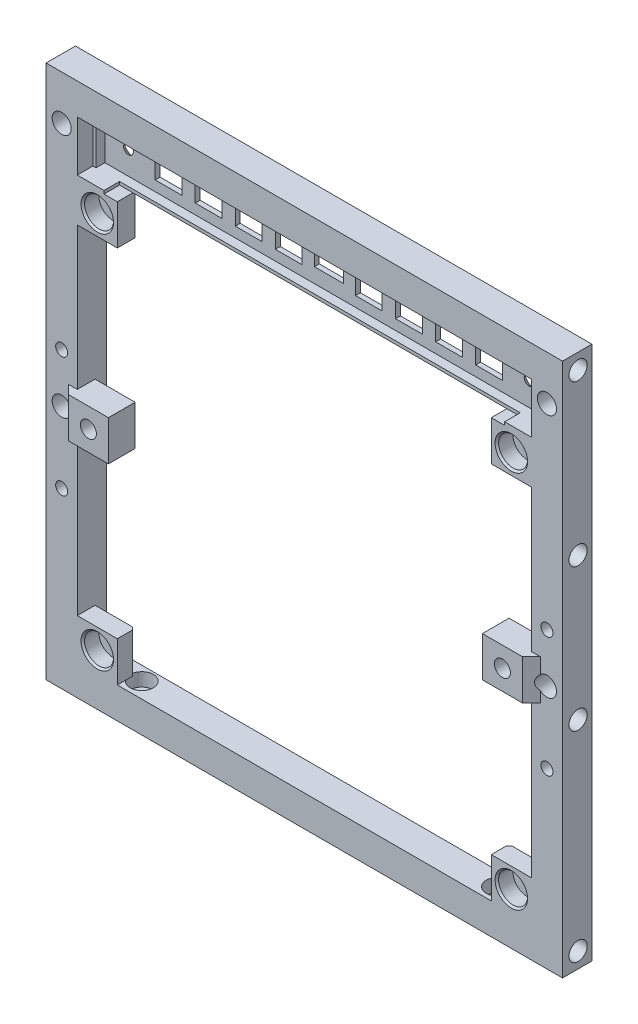
from build123d import *
from build123d.topology import SkipClean

# Parameters (mm, degrees)
SKETCH1_W                = 116
SKETCH1_H                = 120
SKETCH1_W_2              = 102
SKETCH1_H_2              = 106
BOSS_EXTRUDE1_DEPTH      = 7
SKETCH2_R                = 2.05
CUT_EXTRUDE1_DEPTH       = 6
SKETCH3_R                = 1.35
CUT_EXTRUDE2_DEPTH       = 128.208490283
SKETCH4_R                = 2.6
CUT_EXTRUDE3_DEPTH       = 3
SKETCH5_R                = 1.35
CUT_EXTRUDE4_DEPTH       = 84.743656476
SKETCH6_R                = 2.5
CUT_EXTRUDE5_DEPTH       = 3
SKETCH7_R                = 2.15
CUT_EXTRUDE6_DEPTH       = 84.743656476
CUT_EXTRUDE7_DEPTH       = 0.2
SKETCH9_W                = 2.7
SKETCH9_H                = 2.7
CUT_EXTRUDE8_DEPTH       = 0.2
SKETCH10_W               = 6
SKETCH10_H               = 6
BOSS_EXTRUDE2_DEPTH      = 5.5
SKETCH11_R               = 1.65
CUT_EXTRUDE9_DEPTH       = 84.631632771
SKETCH12_W               = 102
SKETCH12_H               = 12
BOSS_EXTRUDE3_DEPTH      = 1.5
SKETCH13_W               = 102
SKETCH13_H               = 12
SKETCH13_W_2             = 100.6
SKETCH13_H_2             = 10.6
BOSS_EXTRUDE4_DEPTH      = 2
SKETCH14_W               = 6
SKETCH14_H               = 6
SKETCH14_W_2             = 6.5
SKETCH14_H_2             = 4
CUT_EXTRUDE10_DEPTH      = 84.631632771
SKETCH15_R               = 1
BOSS_EXTRUDE5_DEPTH      = 2
CHAMFER1_SIZE            = 0.4
CHAMFER2_SIZE            = 0.4
CHAMFER3_SIZE            = 0.4
SKETCH16_W               = 6
SKETCH16_H               = 6
BOSS_EXTRUDE7_DEPTH      = 5.5
SKETCH17_R               = 1.65
CUT_EXTRUDE11_DEPTH      = 84.631632771
CUT_EXTRUDE12_DEPTH      = 84.631632771
CUT_EXTRUDE12_DEPTH_BACK = 84.631632771
SKETCH18_R               = 1.1
CHAMFER4_SIZE            = 1.5
SKETCH19_W               = 102
SKETCH19_H               = 94
CUT_EXTRUDE13_DEPTH      = 84.631632771
SKETCH20_W               = 8
SKETCH20_H               = 8
BOSS_EXTRUDE8_DEPTH      = 7
SKETCH21_R               = 2.15
CUT_EXTRUDE14_DEPTH      = 84.743656476
CHAMFER6_SIZE            = 0.4
CHAMFER7_SIZE            = 0.4
SKETCH22_W               = 102
SKETCH22_H               = 94
CUT_EXTRUDE15_DEPTH      = 84.743656476
BOSS_EXTRUDE9_START      = -4
SKETCH24_W               = 9
SKETCH24_H               = 9
BOSS_EXTRUDE9_DEPTH      = 4
SKETCH25_R               = 3.25
CUT_EXTRUDE16_DEPTH      = 3.6
CHAMFER8_SIZE            = 0.4
CHAMFER9_SIZE            = 0.6
SKETCH26_W               = 9
SKETCH26_H               = 9
BOSS_EXTRUDE10_DEPTH     = 6
SKETCH27_R               = 1.8
CUT_EXTRUDE17_DEPTH      = 84.666002653
CHAMFER10_SIZE           = 2


# Read off the part's stored shape, not the designer's step: Mirror5, Mirror6
# Some blends are built 0.0001 mm under size
with BuildPart() as part:
    # Sketch1 → Boss-Extrude1 (new body)
    with BuildSketch(Plane.XY):
        Rectangle(SKETCH1_W, SKETCH1_H)
        Rectangle(SKETCH1_W_2, SKETCH1_H_2, mode=Mode.SUBTRACT)
    extrude(amount=BOSS_EXTRUDE1_DEPTH)

    # Sketch2 → Cut-Extrude1 (cut)
    with BuildSketch(Plane.ZY.offset(58)):
        with Locations((3.5, -56.5)):
            Circle(SKETCH2_R)
        with Locations((3.5, 56.5)):
            Circle(SKETCH2_R)
        with Locations((3.5, 20.5)):
            Circle(SKETCH2_R)
        with Locations((3.5, -11.5)):
            Circle(SKETCH2_R)
    cut_extrude1 = extrude(amount=-CUT_EXTRUDE1_DEPTH, mode=Mode.SUBTRACT)

    # Mirror1: Cut-Extrude1 across plane
    add(cut_extrude1.mirror(Plane(origin=(0, 0, 0), x_dir=(0, 0, 1), z_dir=(1, 0, 0))), mode=Mode.SUBTRACT)

    # Sketch3 → Cut-Extrude2 (cut, through all)
    with BuildSketch(Plane(origin=(0, -53, 0), x_dir=(1, 0, 0), z_dir=(0, 1, 0))):
        with Locations(Location((40, -3.5, 0), (0, 0, 270))):
            Circle(SKETCH3_R)
        with Locations(Location((-40, -3.5, 0), (0, 0, 270))):
            Circle(SKETCH3_R)
    extrude(amount=-CUT_EXTRUDE2_DEPTH, mode=Mode.SUBTRACT)

    # Sketch4 → Cut-Extrude3 (cut)
    with BuildSketch(Plane(origin=(0, -53, 0), x_dir=(1, 0, 0), z_dir=(0, 1, 0))):
        with Locations(Location((40, -3.5, 0), (0, 0, 270))):
            Circle(SKETCH4_R)
        with Locations(Location((-40, -3.5, 0), (0, 0, 270))):
            Circle(SKETCH4_R)
    extrude(amount=-CUT_EXTRUDE3_DEPTH, mode=Mode.SUBTRACT)

    # Sketch5 → Cut-Extrude4 (cut, through all)
    with BuildSketch(Plane(origin=(0, 0, 0), x_dir=(-1, 0, 0), z_dir=(0, 0, -1))):
        with Locations((-54.5, 6)):
            Circle(SKETCH5_R)
        with Locations(Location((54.5, 6, 0), (0, 0, 180))):
            Circle(SKETCH5_R)
        with Locations((-54.5, -21)):
            Circle(SKETCH5_R)
        with Locations(Location((54.5, -21, 0), (0, 0, 180))):
            Circle(SKETCH5_R)
    extrude(amount=-CUT_EXTRUDE4_DEPTH, mode=Mode.SUBTRACT)

    # Sketch6 → Cut-Extrude5 (cut)
    with BuildSketch(Plane(origin=(0, 0, 0), x_dir=(-1, 0, 0), z_dir=(0, 0, -1))):
        with Locations((-54.5, 6)):
            Circle(SKETCH6_R)
        with Locations((54.5, 6)):
            Circle(SKETCH6_R)
        with Locations((-54.5, -21)):
            Circle(SKETCH6_R)
        with Locations((54.5, -21)):
            Circle(SKETCH6_R)
    extrude(amount=-CUT_EXTRUDE5_DEPTH, mode=Mode.SUBTRACT)

    # Sketch7 → Cut-Extrude6 (cut, through all)
    with BuildSketch(Plane(origin=(0, 0, 0), x_dir=(-1, 0, 0), z_dir=(0, 0, -1))):
        with Locations((-54.5, 50)):
            Circle(SKETCH7_R)
        with Locations((-54.5, -5)):
            Circle(SKETCH7_R)
    cut_extrude6 = extrude(amount=-CUT_EXTRUDE6_DEPTH, mode=Mode.SUBTRACT)

    # Mirror2: Cut-Extrude6 across plane
    add(cut_extrude6.mirror(Plane(origin=(0, 0, 0), x_dir=(0, 0, 1), z_dir=(1, 0, 0))), mode=Mode.SUBTRACT)

    # Sketch8 → Cut-Extrude7 (cut)
    with SkipClean():  # the faces are left unmerged after this step: merging them gives an invalid solid
        with BuildSketch(Plane(origin=(0, 0, 3), x_dir=(-1, 0, 0), z_dir=(0, 0, -1))):
            with BuildLine():
                Line((-55.85, 3.895837459), (-55.85, 8.104162541))
                ThreePointArc((-55.85, 8.104162541), (-54.5, 8.5), (-53.15, 8.104162541))
                Line((-53.15, 8.104162541), (-53.15, 3.895837459))
                ThreePointArc((-53.15, 3.895837459), (-54.5, 3.5), (-55.85, 3.895837459))
            make_face()
            with BuildLine():
                Line((-55.85, -23.104162541), (-55.85, -18.895837459))
                ThreePointArc((-55.85, -18.895837459), (-54.5, -18.5), (-53.15, -18.895837459))
                Line((-53.15, -18.895837459), (-53.15, -23.104162541))
                ThreePointArc((-53.15, -23.104162541), (-54.5, -23.5), (-55.85, -23.104162541))
            make_face()
        cut_extrude7 = extrude(amount=-CUT_EXTRUDE7_DEPTH, mode=Mode.SUBTRACT)

    # Sketch9 → Cut-Extrude8 (cut)
    with SkipClean():  # the faces are left unmerged after this step: merging them gives an invalid solid
        with BuildSketch(Plane(origin=(0, 0, 3.2), x_dir=(-1, 0, 0), z_dir=(0, 0, -1))):
            with Locations((-54.5, 6)):
                Rectangle(SKETCH9_W, SKETCH9_H)
            with Locations((-54.5, -21)):
                Rectangle(SKETCH9_W, SKETCH9_H)
        cut_extrude8 = extrude(amount=-CUT_EXTRUDE8_DEPTH, mode=Mode.SUBTRACT)

    # Mirror3: Cut-Extrude7, Cut-Extrude8 across plane
    with SkipClean():  # the faces are left unmerged after this step: merging them gives an invalid solid
        add(cut_extrude7.mirror(Plane(origin=(0, 0, 0), x_dir=(0, 0, 1), z_dir=(1, 0, 0))), mode=Mode.SUBTRACT)
        add(cut_extrude8.mirror(Plane(origin=(0, 0, 0), x_dir=(0, 0, 1), z_dir=(1, 0, 0))), mode=Mode.SUBTRACT)

    # Sketch10 → Boss-Extrude2 (add)
    with SkipClean():  # the faces are left unmerged after this step: merging them gives an invalid solid
        with BuildSketch(Plane.XY.offset(7)):
            with Locations((48, -50)):
                Rectangle(SKETCH10_W, SKETCH10_H)
            with Locations((48, -20.5)):
                Rectangle(SKETCH10_W, SKETCH10_H)
        boss_extrude2 = extrude(amount=-BOSS_EXTRUDE2_DEPTH)

    # Sketch11 → Cut-Extrude9 (cut, through all)
    with SkipClean():  # the faces are left unmerged after this step: merging them gives an invalid solid
        with BuildSketch(Plane(origin=(0, 0, 1.5), x_dir=(-1, 0, 0), z_dir=(0, 0, -1))):
            with Locations((-48, -20.5)):
                Circle(SKETCH11_R)
            with Locations((-48, -50)):
                Circle(SKETCH11_R)
        cut_extrude9 = extrude(amount=-CUT_EXTRUDE9_DEPTH, mode=Mode.SUBTRACT)

    # Mirror4: Boss-Extrude2, Cut-Extrude9 across plane
    with SkipClean():  # the faces are left unmerged after this step: merging them gives an invalid solid
        add(boss_extrude2.mirror(Plane(origin=(0, 0, 0), x_dir=(0, 0, 1), z_dir=(1, 0, 0))))
        add(cut_extrude9.mirror(Plane(origin=(0, 0, 0), x_dir=(0, 0, 1), z_dir=(1, 0, 0))), mode=Mode.SUBTRACT)

    # Sketch12 → Boss-Extrude3 (add)
    with SkipClean():  # the faces are left unmerged after this step: merging them gives an invalid solid
        with BuildSketch(Plane(origin=(0, 0, 0), x_dir=(-1, 0, 0), z_dir=(0, 0, -1))):
            with Locations((0, 47)):
                Rectangle(SKETCH12_W, SKETCH12_H)
        extrude(amount=-BOSS_EXTRUDE3_DEPTH)

    # Sketch13 → Boss-Extrude4 (add)
    with SkipClean():  # the faces are left unmerged after this step: merging them gives an invalid solid
        with BuildSketch(Plane.XY.offset(1.5)):
            with Locations((0, 47)):
                Rectangle(SKETCH13_W, SKETCH13_H)
            with Locations((0, 47)):
                Rectangle(SKETCH13_W_2, SKETCH13_H_2, mode=Mode.SUBTRACT)
        extrude(amount=BOSS_EXTRUDE4_DEPTH)

    # Sketch14 → Cut-Extrude10 (cut, through all)
    with SkipClean():  # the faces are left unmerged after this step: merging them gives an invalid solid
        with BuildSketch(Plane.XY.offset(1.5)):
            with Locations((-36, 47)):
                Rectangle(SKETCH14_W, SKETCH14_H)
            with Locations((0, 47)):
                Rectangle(SKETCH14_W_2, SKETCH14_H_2)
            with Locations((9, 47)):
                Rectangle(SKETCH14_W, SKETCH14_H)
            with Locations((18, 47)):
                Rectangle(SKETCH14_W, SKETCH14_H)
            with Locations((27, 47)):
                Rectangle(SKETCH14_W, SKETCH14_H)
            with Locations((36, 47)):
                Rectangle(SKETCH14_W, SKETCH14_H)
            with Locations((-27, 47)):
                Rectangle(SKETCH14_W, SKETCH14_H)
            with Locations((-18, 47)):
                Rectangle(SKETCH14_W, SKETCH14_H)
            with Locations((-9, 47)):
                Rectangle(SKETCH14_W, SKETCH14_H)
        extrude(amount=-CUT_EXTRUDE10_DEPTH, mode=Mode.SUBTRACT)

    # Sketch15 → Boss-Extrude5 (add)
    with SkipClean():  # the faces are left unmerged after this step: merging them gives an invalid solid
        with BuildSketch(Plane.XY.offset(1.5)):
            with Locations(Location((-45, 47, 0), (0, 0, 180))):
                Circle(SKETCH15_R)
            with Locations(Location((45, 47, 0), (0, 0, 180))):
                Circle(SKETCH15_R)
        extrude(amount=BOSS_EXTRUDE5_DEPTH)

    # Chamfer1
    # the kernel refuses this chamfer: 0.4 mm, written as the material it takes off along each edge
    with BuildSketch(Plane(origin=(51, -53, 0), x_dir=(0.9996219169112968, 0, -0.02749587661058673), z_dir=(0, 1, 0)), Plane(origin=(-51, 41, 0), x_dir=(-0.9996219169112968, 0, -0.02749587661058673), z_dir=(0, -1, 0))) as chamfer1_piece_1:
        Polygon((CHAMFER1_SIZE * 0.999621916911, -CHAMFER1_SIZE * 0.0274958766106), (-CHAMFER1_SIZE * 0.0274958766106, -CHAMFER1_SIZE * 0.999621916911), (0, 0), align=None)
    extrude(amount=94, mode=Mode.SUBTRACT)
    with BuildSketch(Plane(origin=(-51, -53, 0), x_dir=(0, -0.9996219169112968, -0.02749587661058673), z_dir=(1, 0, 0))) as chamfer1_piece_2:
        Polygon((CHAMFER1_SIZE * 0.999621916911, -CHAMFER1_SIZE * 0.0274958766106), (-CHAMFER1_SIZE * 0.0274958766106, -CHAMFER1_SIZE * 0.999621916911), (0, 0), align=None)
    extrude(amount=102, mode=Mode.SUBTRACT)
    with BuildSketch(Plane(origin=(-51, 41, 0), x_dir=(0, 0.9996219169112968, -0.02749587661058673), z_dir=(1, 0, 0))) as chamfer1_piece_3:
        Polygon((CHAMFER1_SIZE * 0.999621916911, CHAMFER1_SIZE * 0.0274958766106), (-CHAMFER1_SIZE * 0.0274958766106, CHAMFER1_SIZE * 0.999621916911), (0, 0), align=None)
    extrude(amount=102, mode=Mode.SUBTRACT)
    with BuildSketch(Plane(origin=(-51, -53, 0), x_dir=(0, -0.9996219169112968, -0.02749587661058673), z_dir=(1, 0, 0))) as chamfer1_piece_4a_section:
        Polygon((CHAMFER1_SIZE * 0.999621916911, -CHAMFER1_SIZE * 0.0274958766106), (-CHAMFER1_SIZE * 0.0274958766106, -CHAMFER1_SIZE * 0.999621916911), (0, 0), align=None)
    chamfer1_piece_4a = extrude(amount=103.028673195, mode=Mode.PRIVATE)
    chamfer1_piece_4a = split(chamfer1_piece_4a, bisect_by=Plane(origin=(51, -53.131917451, 0.131917451), z_dir=(1, 0, 0)), keep=Keep.TOP, mode=Mode.PRIVATE)
    with BuildSketch(Plane(origin=(51, -54.028673195, 0), x_dir=(0.9996219169112968, 0, -0.02749587661058673), z_dir=(0, 1, 0))) as chamfer1_piece_4b_section:
        Polygon((CHAMFER1_SIZE * 0.999621916911, -CHAMFER1_SIZE * 0.0274958766106), (-CHAMFER1_SIZE * 0.0274958766106, -CHAMFER1_SIZE * 0.999621916911), (0, 0), align=None)
    chamfer1_piece_4b = extrude(amount=95.028673195, mode=Mode.PRIVATE)
    chamfer1_piece_4b = split(chamfer1_piece_4b, bisect_by=Plane(origin=(51.131917451, -53, 0.131917451), z_dir=(0, -1, 0)), keep=Keep.TOP, mode=Mode.PRIVATE)
    chamfer1_piece_4 = chamfer1_piece_4a & chamfer1_piece_4b
    add(chamfer1_piece_4, mode=Mode.SUBTRACT)
    with BuildSketch(Plane(origin=(51, -53, 0), x_dir=(0.9996219169112968, 0, -0.02749587661058673), z_dir=(0, 1, 0))) as chamfer1_piece_5a_section:
        Polygon((CHAMFER1_SIZE * 0.999621916911, -CHAMFER1_SIZE * 0.0274958766106), (-CHAMFER1_SIZE * 0.0274958766106, -CHAMFER1_SIZE * 0.999621916911), (0, 0), align=None)
    chamfer1_piece_5a = extrude(amount=95.028673195, mode=Mode.PRIVATE)
    chamfer1_piece_5a = split(chamfer1_piece_5a, bisect_by=Plane(origin=(51.131917451, 41, 0.131917451), z_dir=(0, 1, 0)), keep=Keep.TOP, mode=Mode.PRIVATE)
    with BuildSketch(Plane(origin=(-51, 41, 0), x_dir=(0, 0.9996219169112968, -0.02749587661058673), z_dir=(1, 0, 0))) as chamfer1_piece_5b_section:
        Polygon((CHAMFER1_SIZE * 0.999621916911, CHAMFER1_SIZE * 0.0274958766106), (-CHAMFER1_SIZE * 0.0274958766106, CHAMFER1_SIZE * 0.999621916911), (0, 0), align=None)
    chamfer1_piece_5b = extrude(amount=103.028673195, mode=Mode.PRIVATE)
    chamfer1_piece_5b = split(chamfer1_piece_5b, bisect_by=Plane(origin=(51, 41.131917451, 0.131917451), z_dir=(1, 0, 0)), keep=Keep.TOP, mode=Mode.PRIVATE)
    chamfer1_piece_5 = chamfer1_piece_5a & chamfer1_piece_5b
    add(chamfer1_piece_5, mode=Mode.SUBTRACT)
    with BuildSketch(Plane(origin=(-51, 41, 0), x_dir=(-0.9996219169112968, 0, -0.02749587661058673), z_dir=(0, -1, 0))) as chamfer1_piece_6a_section:
        Polygon((CHAMFER1_SIZE * 0.999621916911, -CHAMFER1_SIZE * 0.0274958766106), (-CHAMFER1_SIZE * 0.0274958766106, -CHAMFER1_SIZE * 0.999621916911), (0, 0), align=None)
    chamfer1_piece_6a = extrude(amount=95.028673195, mode=Mode.PRIVATE)
    chamfer1_piece_6a = split(chamfer1_piece_6a, bisect_by=Plane(origin=(-51.131917451, -53, 0.131917451), z_dir=(0, -1, 0)), keep=Keep.TOP, mode=Mode.PRIVATE)
    with BuildSketch(Plane(origin=(-52.028673195, -53, 0), x_dir=(0, -0.9996219169112968, -0.02749587661058673), z_dir=(1, 0, 0))) as chamfer1_piece_6b_section:
        Polygon((CHAMFER1_SIZE * 0.999621916911, -CHAMFER1_SIZE * 0.0274958766106), (-CHAMFER1_SIZE * 0.0274958766106, -CHAMFER1_SIZE * 0.999621916911), (0, 0), align=None)
    chamfer1_piece_6b = extrude(amount=103.028673195, mode=Mode.PRIVATE)
    chamfer1_piece_6b = split(chamfer1_piece_6b, bisect_by=Plane(origin=(-51, -53.131917451, 0.131917451), z_dir=(-1, 0, 0)), keep=Keep.TOP, mode=Mode.PRIVATE)
    chamfer1_piece_6 = chamfer1_piece_6a & chamfer1_piece_6b
    add(chamfer1_piece_6, mode=Mode.SUBTRACT)
    with BuildSketch(Plane(origin=(-51, 42.028673195, 0), x_dir=(-0.9996219169112968, 0, -0.02749587661058673), z_dir=(0, -1, 0))) as chamfer1_piece_7a_section:
        Polygon((CHAMFER1_SIZE * 0.999621916911, -CHAMFER1_SIZE * 0.0274958766106), (-CHAMFER1_SIZE * 0.0274958766106, -CHAMFER1_SIZE * 0.999621916911), (0, 0), align=None)
    chamfer1_piece_7a = extrude(amount=95.028673195, mode=Mode.PRIVATE)
    chamfer1_piece_7a = split(chamfer1_piece_7a, bisect_by=Plane(origin=(-51.131917451, 41, 0.131917451), z_dir=(0, 1, 0)), keep=Keep.TOP, mode=Mode.PRIVATE)
    with BuildSketch(Plane(origin=(-52.028673195, 41, 0), x_dir=(0, 0.9996219169112968, -0.02749587661058673), z_dir=(1, 0, 0))) as chamfer1_piece_7b_section:
        Polygon((CHAMFER1_SIZE * 0.999621916911, CHAMFER1_SIZE * 0.0274958766106), (-CHAMFER1_SIZE * 0.0274958766106, CHAMFER1_SIZE * 0.999621916911), (0, 0), align=None)
    chamfer1_piece_7b = extrude(amount=103.028673195, mode=Mode.PRIVATE)
    chamfer1_piece_7b = split(chamfer1_piece_7b, bisect_by=Plane(origin=(-51, 41.131917451, 0.131917451), z_dir=(-1, 0, 0)), keep=Keep.TOP, mode=Mode.PRIVATE)
    chamfer1_piece_7 = chamfer1_piece_7a & chamfer1_piece_7b
    add(chamfer1_piece_7, mode=Mode.SUBTRACT)

    # Chamfer2
    chamfer2_edges = [part.edges().sort_by_distance(p)[0] for p in [
        (0, -60, 0),
        (-58, 0, 0),
        (0, 60, 0),
        (58, 0, 0),
    ]]
    chamfer(chamfer2_edges, length=CHAMFER2_SIZE)

    # Chamfer3
    chamfer3_edges = [part.edges().sort_by_distance(p)[0] for p in [
        (-6, 47, 0),
        (-9, 44, 0),
        (-12, 47, 0),
        (-9, 50, 0),
        (-15, 47, 0),
        (-18, 44, 0),
        (-21, 47, 0),
        (-18, 50, 0),
        (-24, 47, 0),
        (-27, 44, 0),
        (-30, 47, 0),
        (-27, 50, 0),
        (-33, 47, 0),
        (-36, 44, 0),
        (-39, 47, 0),
        (-36, 50, 0),
        (39, 47, 0),
        (36, 44, 0),
        (33, 47, 0),
        (36, 50, 0),
        (30, 47, 0),
        (27, 44, 0),
        (24, 47, 0),
        (27, 50, 0),
        (21, 47, 0),
        (18, 44, 0),
        (15, 47, 0),
        (18, 50, 0),
        (12, 47, 0),
        (9, 44, 0),
        (6, 47, 0),
        (9, 50, 0),
        (3.25, 47, 0),
        (0, 45, 0),
        (-3.25, 47, 0),
        (0, 49, 0),
    ]]
    chamfer(chamfer3_edges, length=CHAMFER3_SIZE)

    # Sketch16 → Boss-Extrude7 (add)
    with BuildSketch(Plane.XY.offset(7)):
        Polygon((-45, 41), (-45, 41.7), (-51, 41.7), (-51, 41), (-51, 35), (-45, 35), align=None)
        with Locations((-48, -14.5)):
            Rectangle(SKETCH16_W, SKETCH16_H)
        with Locations((48, -14.5)):
            Rectangle(SKETCH16_W, SKETCH16_H)
        Polygon((51, 41), (51, 35), (45, 35), (45, 41), (45, 41.7), (51, 41.7), align=None)
    extrude(amount=-BOSS_EXTRUDE7_DEPTH)

    # Sketch17 → Cut-Extrude11 (cut, through all)
    with BuildSketch(Plane(origin=(0, 0, 1.5), x_dir=(-1, 0, 0), z_dir=(0, 0, -1))):
        with Locations((-48, -14.5)):
            Circle(SKETCH17_R)
        with Locations((48, -14.5)):
            Circle(SKETCH17_R)
        with Locations((48, 38)):
            Circle(SKETCH17_R)
        with Locations((-48, 38)):
            Circle(SKETCH17_R)
    extrude(amount=-CUT_EXTRUDE11_DEPTH, mode=Mode.SUBTRACT)

    # Sketch18 → Cut-Extrude12 (cut, two sides: drawn at the far end of the back side and taken through both)
    with BuildSketch(Plane.XY.offset(1.5).offset(-CUT_EXTRUDE12_DEPTH_BACK)):
        with Locations((-45, 47)):
            Circle(SKETCH18_R)
        with Locations((45, 47)):
            Circle(SKETCH18_R)
    extrude(amount=CUT_EXTRUDE12_DEPTH + CUT_EXTRUDE12_DEPTH_BACK, mode=Mode.SUBTRACT)

    # Chamfer4
    chamfer4_edges = [part.edges().sort_by_distance(p)[0] for p in [
        (-46.1, 47, 0),
        (43.9, 47, 0),
    ]]
    chamfer(chamfer4_edges, length=CHAMFER4_SIZE - 0.0001)  # a hair under: the kernel refuses the full size

    # Sketch19 → Cut-Extrude13 (cut, through all)
    with BuildSketch(Plane(origin=(0, 0, 1.5), x_dir=(-1, 0, 0), z_dir=(0, 0, -1))):
        with Locations((0, -6)):
            Rectangle(SKETCH19_W, SKETCH19_H)
    extrude(amount=-CUT_EXTRUDE13_DEPTH, mode=Mode.SUBTRACT)

    # Sketch20 → Boss-Extrude8 (add)
    with BuildSketch(Plane(origin=(0, 0, 3), x_dir=(-1, 0, 0), z_dir=(0, 0, -1))):
        with Locations((-47, 37)):
            Rectangle(SKETCH20_W, SKETCH20_H)
        with Locations((-47, -49)):
            Rectangle(SKETCH20_W, SKETCH20_H)
        with Locations((47, -49)):
            Rectangle(SKETCH20_W, SKETCH20_H)
        with Locations((47, 37)):
            Rectangle(SKETCH20_W, SKETCH20_H)
    extrude(amount=-BOSS_EXTRUDE8_DEPTH)

    # Sketch21 → Cut-Extrude14 (cut, through all)
    with BuildSketch(Plane(origin=(0, 0, 3), x_dir=(-1, 0, 0), z_dir=(0, 0, -1))):
        with Locations((-47, 37)):
            Circle(SKETCH21_R)
        with Locations((-47, -49)):
            Circle(SKETCH21_R)
        with Locations(Location((47, -49, 0), (0, 0, 180))):
            Circle(SKETCH21_R)
        with Locations(Location((47, 37, 0), (0, 0, 180))):
            Circle(SKETCH21_R)
    extrude(amount=-CUT_EXTRUDE14_DEPTH, mode=Mode.SUBTRACT)

    # Chamfer6
    chamfer6_edges = [part.edges().sort_by_distance(p)[0] for p in [
        (-49.15, 37, 3),
        (-49.15, -49, 3),
        (49.15, -49, 3),
        (49.15, 37, 3),
    ]]
    chamfer(chamfer6_edges, length=CHAMFER6_SIZE)

    # Chamfer7
    chamfer7_edges = [part.edges().sort_by_distance(p)[0] for p in [
        (56.65, -5, 0),
        (56.65, 50, 0),
        (-56.65, -5, 0),
        (-56.65, 50, 0),
    ]]
    chamfer(chamfer7_edges, length=CHAMFER7_SIZE)

    # Sketch22 → Cut-Extrude15 (cut, through all)
    with BuildSketch(Plane(origin=(0, 0, 3), x_dir=(-1, 0, 0), z_dir=(0, 0, -1))):
        with Locations((0, -6)):
            Rectangle(SKETCH22_W, SKETCH22_H)
    extrude(amount=-CUT_EXTRUDE15_DEPTH, mode=Mode.SUBTRACT)

    # Sketch24 → Boss-Extrude9 (add)
    with BuildSketch(Plane(origin=(0, 0, 3), x_dir=(-1, 0, 0), z_dir=(0, 0, -1)).offset(BOSS_EXTRUDE9_START)):
        with Locations((-46.5, 36.5)):
            Rectangle(SKETCH24_W, SKETCH24_H)
        with Locations((-46.5, -48.5)):
            Rectangle(SKETCH24_W, SKETCH24_H)
    extrude(amount=BOSS_EXTRUDE9_DEPTH)

    # Sketch25 → Cut-Extrude16 (cut)
    with BuildSketch(Plane.XY.offset(7)):
        with Locations((46.5, 36.5)):
            Circle(SKETCH25_R)
        with Locations((46.5, -48.5)):
            Circle(SKETCH25_R)
    extrude(amount=-CUT_EXTRUDE16_DEPTH, mode=Mode.SUBTRACT)

    # Chamfer8
    chamfer8_edges = [part.edges().sort_by_distance(p)[0] for p in [
        (43.25, 36.5, 7),
        (43.25, -48.5, 7),
    ]]
    chamfer(chamfer8_edges, length=CHAMFER8_SIZE)

    # Chamfer9
    # the kernel refuses this chamfer: 0.6 mm, written as the material it takes off along each edge
    with BuildSketch(Plane(origin=(42, -53, 3), x_dir=(0.9996219169112968, 0, -0.027495876610586622), z_dir=(0, 1, 0))) as chamfer9_piece_1:
        Polygon((CHAMFER9_SIZE * 0.999621916911, -CHAMFER9_SIZE * 0.0274958766106), (-CHAMFER9_SIZE * 0.0274958766106, -CHAMFER9_SIZE * 0.999621916911), (0, 0), align=None)
    extrude(amount=10.543009793, mode=Mode.SUBTRACT)

    # Mirror5: part across plane


with BuildPart() as part_1:
    add(part.part)
    add(part.part.mirror(Plane(origin=(0, 0, 0), x_dir=(0, 0, 1), z_dir=(1, 0, 0))))

    # Sketch26 → Boss-Extrude10 (add)
    with BuildSketch(Plane(origin=(0, 0, 3), x_dir=(-1, 0, 0), z_dir=(0, 0, -1))):
        with Locations((-46.5, -4.5)):
            Rectangle(SKETCH26_W, SKETCH26_H)
    extrude(amount=-BOSS_EXTRUDE10_DEPTH)

    # Sketch27 → Cut-Extrude17 (cut, through all)
    with BuildSketch(Plane(origin=(0, 0, 3), x_dir=(-1, 0, 0), z_dir=(0, 0, -1))):
        with Locations((-46.5, -4.5)):
            Circle(SKETCH27_R)
    extrude(amount=-CUT_EXTRUDE17_DEPTH, mode=Mode.SUBTRACT)

    # Chamfer10
    # the kernel refuses this chamfer: 2 mm, written as the material it adds along each edge
    with BuildSketch(Plane(origin=(51, -9, 7), x_dir=(0.9996219169112968, 0, -0.02749587661058651), z_dir=(0, 1, 0))) as chamfer10_piece_1_section:
        Polygon((CHAMFER10_SIZE * 0.999621916911, -CHAMFER10_SIZE * 0.0274958766106), (-CHAMFER10_SIZE * 0.0274958766106, -CHAMFER10_SIZE * 0.999621916911), (0, 0), align=None)
    chamfer10_piece_1 = extrude(amount=9, mode=Mode.PRIVATE)
    chamfer10_piece_1 = chamfer10_piece_1 - Plane(origin=(54.5, -5, 7.676570575), x_dir=(-1, 0, 0), z_dir=(0, 0, -1)) * Cylinder(2.15, 26, mode=Mode.PRIVATE)
    add(chamfer10_piece_1)

    # Mirror6
    split(bisect_by=Plane(origin=(0, 0, 0), x_dir=(0, 0, 1), z_dir=(1, 0, 0)), keep=Keep.TOP)

    # Mirror6 2: part across plane


with BuildPart() as part_2:
    add(part_1.part)
    add(part_1.part.mirror(Plane(origin=(0, 0, 0), x_dir=(0, 0, 1), z_dir=(1, 0, 0))))


solid = part_2.part
